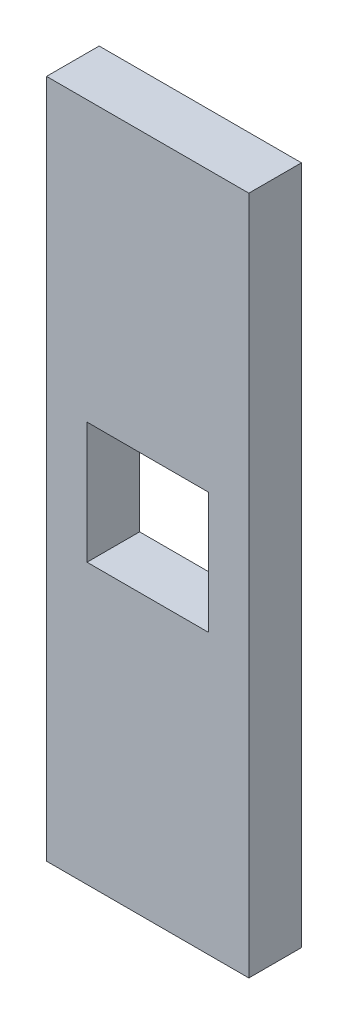
from build123d import *

# Parameters (mm, degrees)
SKETCH1_W           = 12
SKETCH1_H           = 12
BOSS_EXTRUDE1_DEPTH = 5.2


with BuildPart() as part:
    # Sketch1 → Boss-Extrude1 (new body)
    with BuildSketch(Plane.XY):
        Polygon((0, 67.2), (0, 44.8), (0, 39.6), (0, 27.6), (0, 22.4), (0, 0), (20, 0), (20, 22.4), (20, 27.6), (20, 39.6), (20, 44.8), (20, 67.2), align=None)
        with Locations((10, 33.6)):
            Rectangle(SKETCH1_W, SKETCH1_H, mode=Mode.SUBTRACT)
    extrude(amount=BOSS_EXTRUDE1_DEPTH)


solid = part.part
